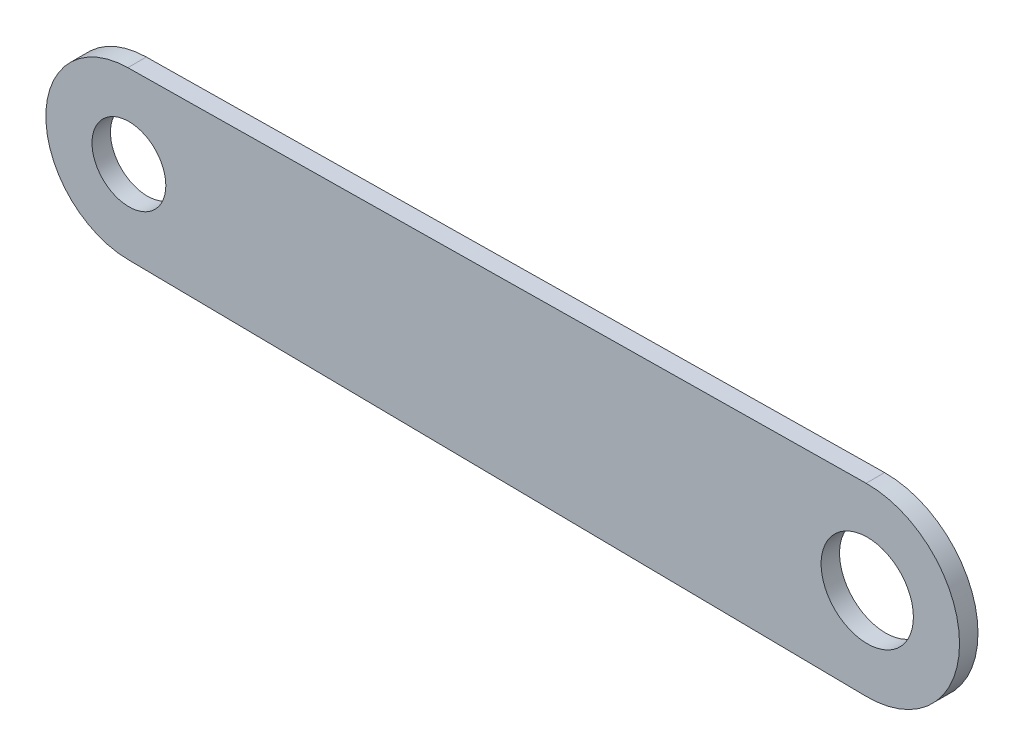
from build123d import *

# Parameters (mm, degrees)
SKETCH_2_R             = 8
SKETCH_2_R_2           = 10
SM_BASE_FLANGE_1_DEPTH = 4


# Sheet-metal steps are written as plain solids
with BuildPart() as part:
    # Sketch 2 → Базовая кромка1 (new body)
    with BuildSketch(Plane.XY):
        with BuildLine():
            Line((-160.225, 17.998593695), (-0.25, 19.998437439))
            ThreePointArc((-0.25, 19.998437439), (20, 0), (-0.25, -19.998437439))
            Line((-0.25, -19.998437439), (-160.225, -17.998593695))
            ThreePointArc((-160.225, -17.998593695), (-178, 0), (-160.225, 17.998593695))
        make_face()
        with Locations((-160, 0)):
            Circle(SKETCH_2_R, mode=Mode.SUBTRACT)
        Circle(SKETCH_2_R_2, mode=Mode.SUBTRACT)
    extrude(amount=-SM_BASE_FLANGE_1_DEPTH)


solid = part.part
